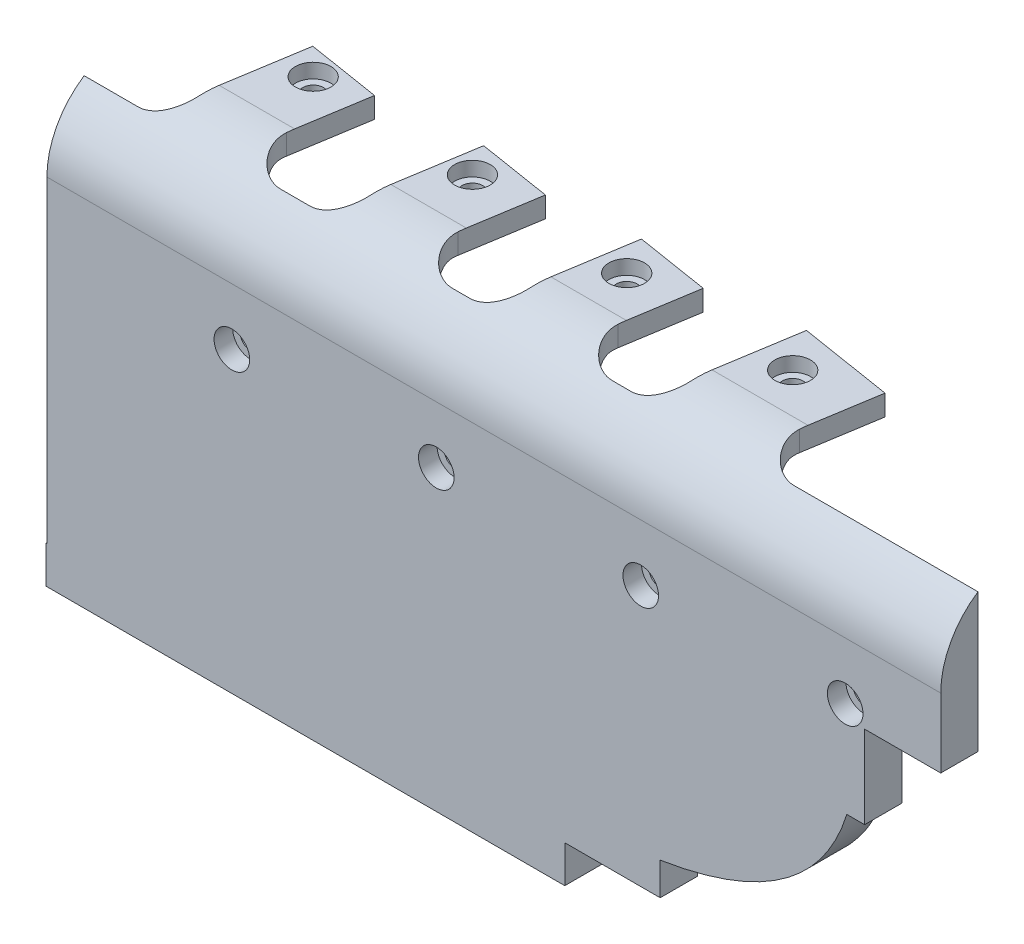
from build123d import *

# Parameters (mm, degrees)
SKETCH1_W              = 24.7
SKETCH1_H              = 21
SKETCH1_R              = 1.05
SKETCH1_R_2            = 1.85000003
SKETCH1_R_3            = 1.050000015
BOSS_EXTRUDE1_DEPTH    = 2
LPATTERN1_COUNT        = 4
LPATTERN1_PITCH        = 24.7
SKETCH3_W              = 98.8
SKETCH3_H              = 21
SKETCH3_R              = 1.85000003
BOSS_EXTRUDE2_DEPTH    = 2.5
SKETCH4_W              = 98.8
SKETCH4_H              = 4.5
BOSS_EXTRUDE3_DEPTH    = 7.36771
SKETCH6_W              = 4.5
SKETCH6_H              = 18.36771
BOSS_EXTRUDE4_DEPTH    = 9.198019
SKETCH7_W              = 74.1
SKETCH7_H              = 4.5
BOSS_EXTRUDE5_DEPTH    = 20
SKETCH8_W              = 53.178454151
SKETCH8_H              = 4.5
BOSS_EXTRUDE6_DEPTH    = 4.5
BOSS_EXTRUDE7_DEPTH    = 4.75
BOSS_EXTRUDE8_DEPTH    = 2.5
SKETCH14_W             = 4.5
SKETCH14_H             = 4.5
BOSS_EXTRUDE9_DEPTH    = 9.5
FILLET1_R              = 4
FILLET2_R              = 10
CAVITY1_START          = 26.61771
CAVITY1_OUTLINE_R      = 2.15
CAVITY1_DEPTH          = 1.75
CAVITY1_START_2        = 25.86771
CAVITY1_2_OUTLINE_R    = 1.25
CAVITY1_2_DEPTH        = 0.75
BOSS_EXTRUDE10_START   = -4.5
SKETCH15_R             = 1.85000003
SKETCH15_R_2           = 1
BOSS_EXTRUDE10_DEPTH   = 4.5
CAVITY13_START         = 2.25
CAVITY13_OUTLINE_R     = 2.15
CAVITY13_OUTLINE_R_2   = 1
CAVITY13_DEPTH         = 2.25
CAVITY13_2_OUTLINE_R   = 1.25
CAVITY13_2_OUTLINE_R_2 = 1
CAVITY13_2_DEPTH       = 2.25
FILLET4_R              = 4


# Read off the part's stored shape, not the designer's step: Cavity1, Cavity13
# Some blends are built 0.0001 mm under size
with BuildPart() as part:
    # Sketch1 → Boss-Extrude1 (new body)
    with BuildSketch(Plane.XY):
        with Locations((12.35, 10.5)):
            Rectangle(SKETCH1_W, SKETCH1_H)
        with Locations((22.850000164, 18.500000119)):
            Circle(SKETCH1_R, mode=Mode.SUBTRACT)
        with Locations((22.850000164, 15.500000119)):
            Circle(SKETCH1_R, mode=Mode.SUBTRACT)
        with Locations((22.350000149, 11.500000015)):
            Circle(SKETCH1_R_2, mode=Mode.SUBTRACT)
        with Locations((20.350000119, 8.49999997)):
            Circle(SKETCH1_R_3, mode=Mode.SUBTRACT)
        with Locations((20.350000119, 6.166666637)):
            Circle(SKETCH1_R_3, mode=Mode.SUBTRACT)
        with Locations((20.350000119, 3.833333304)):
            Circle(SKETCH1_R_3, mode=Mode.SUBTRACT)
        with Locations((20.350000119, 1.49999997)):
            Circle(SKETCH1_R_3, mode=Mode.SUBTRACT)
        with Locations((4.349999881, 8.49999997)):
            Circle(SKETCH1_R_3, mode=Mode.SUBTRACT)
        with Locations((4.349999881, 6.166666637)):
            Circle(SKETCH1_R_3, mode=Mode.SUBTRACT)
        with Locations((4.349999881, 3.833333304)):
            Circle(SKETCH1_R_3, mode=Mode.SUBTRACT)
        with Locations((4.349999881, 1.49999997)):
            Circle(SKETCH1_R_3, mode=Mode.SUBTRACT)
    boss_extrude1 = extrude(amount=BOSS_EXTRUDE1_DEPTH)

    # LPattern1: Boss-Extrude1 ×4
    with Locations(*[(-i * LPATTERN1_PITCH, 0, 0) for i in range(1, LPATTERN1_COUNT)]):
        add(boss_extrude1)

    # Sketch3 → Boss-Extrude2 (add)
    with BuildSketch(Plane.XY.offset(2)):
        with Locations((-24.7, 10.5)):
            Rectangle(SKETCH3_W, SKETCH3_H)
        with Locations((-51.749999851, 11.500000015)):
            Circle(SKETCH3_R, mode=Mode.SUBTRACT)
        with Locations((-27.049999851, 11.500000015)):
            Circle(SKETCH3_R, mode=Mode.SUBTRACT)
        with Locations((-2.349999851, 11.500000015)):
            Circle(SKETCH3_R, mode=Mode.SUBTRACT)
        with Locations((22.350000149, 11.500000015)):
            Circle(SKETCH3_R, mode=Mode.SUBTRACT)
    extrude(amount=BOSS_EXTRUDE2_DEPTH)

    # Sketch4 → Boss-Extrude3 (add)
    with BuildSketch(Plane(origin=(0, 21, 0), x_dir=(1, 0, 0), z_dir=(0, 1, 0))):
        with Locations((-24.7, -2.25)):
            Rectangle(SKETCH4_W, SKETCH4_H)
    extrude(amount=BOSS_EXTRUDE3_DEPTH)

    # Sketch6 → Boss-Extrude4 (add)
    with BuildSketch(Plane(origin=(24.7, 0, 0), x_dir=(0, 0, -1), z_dir=(1, 0, 0))):
        with Locations((-2.25, 19.183855)):
            Rectangle(SKETCH6_W, SKETCH6_H)
    extrude(amount=BOSS_EXTRUDE4_DEPTH)

    # Sketch7 → Boss-Extrude5 (add)
    with BuildSketch(Plane.XZ):
        with Locations((-37.05, 2.25)):
            Rectangle(SKETCH7_W, SKETCH7_H)
    extrude(amount=BOSS_EXTRUDE5_DEPTH)

    # Sketch8 → Boss-Extrude6 (add)
    with BuildSketch(Plane.XZ.offset(20)):
        with Locations((-38.117142498, 2.25)):
            Rectangle(SKETCH8_W, SKETCH8_H)
    extrude(amount=BOSS_EXTRUDE6_DEPTH)

    # Sketch9 → Boss-Extrude7 (add)
    with BuildSketch(Plane.XY.offset(4.5)):
        with BuildLine():
            Line((0, 0), (0, -16.059466978))
            add(Edge.make_bspline(
                [(0, -16.059466978), (18.484574141, -13.097711422), (22.548154032, 0)],
                knots=[0, 0, 0, 0.956663175, 0.956663175, 0.956663175], degree=2))
            Line((22.548154032, 0), (0, 0))
        make_face()
    extrude(amount=-BOSS_EXTRUDE7_DEPTH)

    # Sketch10 → Boss-Extrude8 (add)
    with BuildSketch(Plane(origin=(0, 28.36771, 0), x_dir=(1, 0, 0), z_dir=(0, 1, 0))):
        Polygon((-64.88730383, -4.5), (-61.722013793, 15.247935056), (-52.835443017, 13.823554539), (-55.051146044, 0), (-43.421268353, 0), (-40.991049642, 15.161896923), (-32.104478867, 13.737516406), (-34.306391305, 0), (-24.086432643, 0), (-21.693532902, 14.929067518), (-12.806962127, 13.504687001), (-15.036483854, -0.405081066), (-4.619230317, 0), (-2.161338866, 15.334544441), (9.14228964, 13.522746772), (6.974801469, 0), (6.974801469, -4.5), align=None)
    extrude(amount=-BOSS_EXTRUDE8_DEPTH)

    # Sketch14 → Boss-Extrude9 (add)
    with BuildSketch(Plane.ZY.offset(64.706369573)):
        with Locations((2.25, -22.25)):
            Rectangle(SKETCH14_W, SKETCH14_H)
    extrude(amount=BOSS_EXTRUDE9_DEPTH)

    # Fillet1
    fillet1_edges = [part.edges().sort_by_distance(p)[0] for p in [
        (6.974801469, 27.11771, 0),
        (-4.619230317, 27.11771, 0),
        (-14.971555594, 27.11771, 0),
        (-24.086432643, 27.11771, 0),
        (-34.306391305, 27.11771, 0),
        (-43.421268353, 27.11771, 0),
        (-55.051146044, 27.11771, 0),
        (-64.166023092, 27.11771, 0),
    ]]
    fillet(fillet1_edges, radius=FILLET1_R)

    # Fillet2
    # the kernel refuses this fillet: 10 mm, written as the material it takes off along each edge
    with BuildSketch(Plane(origin=(-99.1, 28.36771, 4.5), x_dir=(0, -1, 0), z_dir=(1, 0, 0))) as fillet2_piece_1:
        with BuildLine():
            CenterArc((FILLET2_R, FILLET2_R), FILLET2_R, 180, 90)
            Line((0, FILLET2_R), (0, 0))
            Line((0, 0), (FILLET2_R, 0))
        make_face()
    extrude(amount=157.998019, mode=Mode.SUBTRACT)

    # Cavity1 outline → Cavity1 (cut)
    with BuildSketch(Plane(origin=(0, 0, 0), x_dir=(1, 0, 0), z_dir=(0, 1, 0)).offset(CAVITY1_START)):
        with Locations((-58.504333441, 12.07448251)):
            Circle(CAVITY1_OUTLINE_R)
        with Locations((-38.625660008, 11.438398712)):
            Circle(CAVITY1_OUTLINE_R)
        with Locations((-19.015607268, 10.469318011)):
            Circle(CAVITY1_OUTLINE_R)
        with Locations((1.164647736, 10.344182698)):
            Circle(CAVITY1_OUTLINE_R)
    extrude(amount=CAVITY1_DEPTH, mode=Mode.SUBTRACT)

    # Cavity1 2 outline → Cavity1 2 (cut)
    with BuildSketch(Plane(origin=(0, 0, 0), x_dir=(1, 0, 0), z_dir=(0, 1, 0)).offset(CAVITY1_START_2)):
        with Locations((-58.504333441, 12.07448251)):
            Circle(CAVITY1_2_OUTLINE_R)
        with Locations((-38.625660008, 11.438398712)):
            Circle(CAVITY1_2_OUTLINE_R)
        with Locations((-19.015607268, 10.469318011)):
            Circle(CAVITY1_2_OUTLINE_R)
        with Locations((1.164647736, 10.344182698)):
            Circle(CAVITY1_2_OUTLINE_R)
    extrude(amount=CAVITY1_2_DEPTH, mode=Mode.SUBTRACT)

    # Sketch15 → Boss-Extrude10 (add)
    # profile 1 of 4: a face of its own
    with BuildSketch(Plane.XY.offset(4.5).offset(BOSS_EXTRUDE10_START)):
        with Locations((22.350000149, 11.500000015)):
            Circle(SKETCH15_R)
        with Locations((22.350000149, 11.500000015)):
            Circle(SKETCH15_R_2, mode=Mode.SUBTRACT)
    # profile 2 of 4: a face of its own
    with BuildSketch(Plane.XY.offset(4.5).offset(BOSS_EXTRUDE10_START)):
        with Locations((-2.349999851, 11.500000015)):
            Circle(SKETCH15_R)
        with Locations((-2.349999851, 11.500000015)):
            Circle(SKETCH15_R_2, mode=Mode.SUBTRACT)
    # profile 3 of 4: a face of its own
    with BuildSketch(Plane.XY.offset(4.5).offset(BOSS_EXTRUDE10_START)):
        with Locations((-27.049999851, 11.500000015)):
            Circle(SKETCH15_R)
        with Locations((-27.049999851, 11.500000015)):
            Circle(SKETCH15_R_2, mode=Mode.SUBTRACT)
    # profile 4 of 4: a face of its own
    with BuildSketch(Plane.XY.offset(4.5).offset(BOSS_EXTRUDE10_START)):
        with Locations((-51.749999851, 11.500000015)):
            Circle(SKETCH15_R)
        with Locations((-51.749999851, 11.500000015)):
            Circle(SKETCH15_R_2, mode=Mode.SUBTRACT)
    extrude(amount=BOSS_EXTRUDE10_DEPTH)

    # Cavity13 outline → Cavity13 (cut)
    # profile 1 of 4: a face of its own
    with BuildSketch(Plane.XY.offset(CAVITY13_START)):
        with Locations((22.350000149, 11.500000015)):
            Circle(CAVITY13_OUTLINE_R)
        with Locations((22.350000149, 11.500000015)):
            Circle(CAVITY13_OUTLINE_R_2, mode=Mode.SUBTRACT)
    # profile 2 of 4: a face of its own
    with BuildSketch(Plane.XY.offset(CAVITY13_START)):
        with Locations((-27.049999851, 11.500000015)):
            Circle(CAVITY13_OUTLINE_R)
        with Locations((-27.049999851, 11.500000015)):
            Circle(CAVITY13_OUTLINE_R_2, mode=Mode.SUBTRACT)
    # profile 3 of 4: a face of its own
    with BuildSketch(Plane.XY.offset(CAVITY13_START)):
        with Locations((-2.349999851, 11.500000015)):
            Circle(CAVITY13_OUTLINE_R)
        with Locations((-2.349999851, 11.500000015)):
            Circle(CAVITY13_OUTLINE_R_2, mode=Mode.SUBTRACT)
    # profile 4 of 4: a face of its own
    with BuildSketch(Plane.XY.offset(CAVITY13_START)):
        with Locations((-51.749999851, 11.500000015)):
            Circle(CAVITY13_OUTLINE_R)
        with Locations((-51.749999851, 11.500000015)):
            Circle(CAVITY13_OUTLINE_R_2, mode=Mode.SUBTRACT)
    extrude(amount=CAVITY13_DEPTH, mode=Mode.SUBTRACT)

    # Cavity13 2 outline → Cavity13 2 (cut)
    # profile 1 of 4: a face of its own
    with BuildSketch(Plane.XY):
        with Locations((22.350000149, 11.500000015)):
            Circle(CAVITY13_2_OUTLINE_R)
        with Locations((22.350000149, 11.500000015)):
            Circle(CAVITY13_2_OUTLINE_R_2, mode=Mode.SUBTRACT)
    # profile 2 of 4: a face of its own
    with BuildSketch(Plane.XY):
        with Locations((-27.049999851, 11.500000015)):
            Circle(CAVITY13_2_OUTLINE_R)
        with Locations((-27.049999851, 11.500000015)):
            Circle(CAVITY13_2_OUTLINE_R_2, mode=Mode.SUBTRACT)
    # profile 3 of 4: a face of its own
    with BuildSketch(Plane.XY):
        with Locations((-2.349999851, 11.500000015)):
            Circle(CAVITY13_2_OUTLINE_R)
        with Locations((-2.349999851, 11.500000015)):
            Circle(CAVITY13_2_OUTLINE_R_2, mode=Mode.SUBTRACT)
    # profile 4 of 4: a face of its own
    with BuildSketch(Plane.XY):
        with Locations((-51.749999851, 11.500000015)):
            Circle(CAVITY13_2_OUTLINE_R)
        with Locations((-51.749999851, 11.500000015)):
            Circle(CAVITY13_2_OUTLINE_R_2, mode=Mode.SUBTRACT)
    extrude(amount=CAVITY13_2_DEPTH, mode=Mode.SUBTRACT)

    # Fillet4
    fillet4_edges = [part.edges().sort_by_distance(p)[0] for p in [
        (-58.967446134, 25.86771, 0),
        (-38.222691395, 25.86771, 0),
        (-18.887855685, 25.86771, 0),
        (1.81892401, 25.86771, 0),
    ]]
    fillet(fillet4_edges, radius=FILLET4_R - 0.0001)  # a hair under: the kernel refuses the full size


solid = part.part
